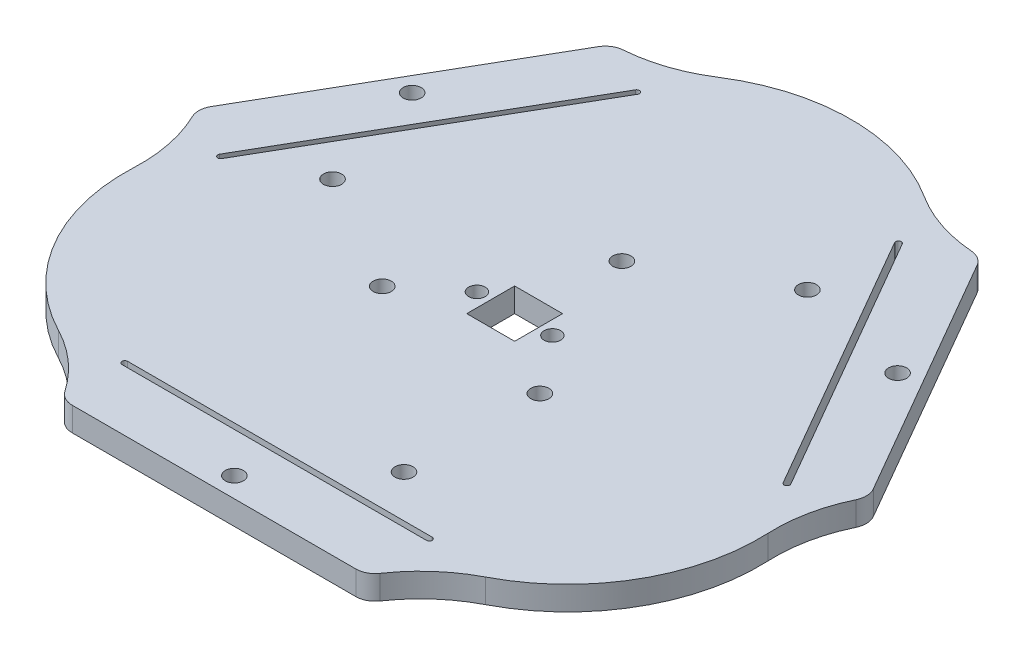
from build123d import *

# Parameters (mm, degrees)
SKETCH4_R           = 1.0999978
BOSS_EXTRUDE4_DEPTH = 3.175
SKETCH1_R           = 1.1999976
CUT_EXTRUDE7_DEPTH  = 62.35209393
CUT_EXTRUDE9_DEPTH  = 62.35209393
CIRPATTERN1_COUNT   = 3
SKETCH9_W           = 40.35933
SKETCH9_H           = 5.08
BOSS_EXTRUDE5_DEPTH = 3.175
SKETCH10_R          = 1.2
CUT_EXTRUDE10_DEPTH = 64.132493246
CIRPATTERN2_COUNT   = 3
FILLET3_R           = 20.32
FILLET4_R           = 2.54
SKETCH13_W          = 6.35
SKETCH13_H          = 6.35
CUT_EXTRUDE12_DEPTH = 63.881962359


with BuildPart() as part:
    # Sketch4 → Boss-Extrude4 (new body)
    with BuildSketch(Plane(origin=(0, 0, 0), x_dir=(1, 0, 0), z_dir=(0, 1, 0))):
        with BuildLine():
            Line((-19.99996, 34.84845233), (-40.179625, -0.10375273))
            ThreePointArc((-40.179625, -0.10375273), (-38.616778752, -22.295407608), (-20.179665, -34.744699599))
            Line((-20.179665, -34.744699599), (0, -34.744699599))
            Line((0, -34.744699599), (20.179665, -34.744699599))
            ThreePointArc((20.179665, -34.744699599), (38.616778752, -22.295407608), (40.179625, -0.10375273))
            Line((40.179625, -0.10375273), (30.0897925, 17.3723498))
            Line((30.0897925, 17.3723498), (19.99996, 34.84845233))
            ThreePointArc((19.99996, 34.84845233), (0, 44.590815215), (-19.99996, 34.84845233))
        make_face()
        with Locations(Location((-5.000000033, 0, 0), (0, 0, 270))):
            Circle(SKETCH4_R, mode=Mode.SUBTRACT)
        with Locations(Location((5.000000033, 0, 0), (0, 0, 270))):
            Circle(SKETCH4_R, mode=Mode.SUBTRACT)
    extrude(amount=BOSS_EXTRUDE4_DEPTH)

    # Sketch1 → Cut-Extrude7 (cut, through all)
    with BuildSketch(Plane(origin=(0, 3.175, 0), x_dir=(1, 0, 0), z_dir=(0, 1, 0))):
        with Locations(Location((10.835999918, -25.497765942, 0), (0, 0, 270))):
            Circle(SKETCH1_R)
        with Locations(Location((10.835999918, -7.497801942, 0), (0, 0, 270))):
            Circle(SKETCH1_R)
        with Locations(Location((-11.911286913, -5.635350233, 0), (0, 0, 270))):
            Circle(SKETCH1_R)
        with Locations(Location((-27.499713005, 3.364631767, 0), (0, 0, 270))):
            Circle(SKETCH1_R)
        with Locations(Location((1.075286995, 13.133152175, 0), (0, 0, 270))):
            Circle(SKETCH1_R)
        with Locations(Location((16.663713087, 22.133134175, 0), (0, 0, 270))):
            Circle(SKETCH1_R)
    extrude(amount=-CUT_EXTRUDE7_DEPTH, mode=Mode.SUBTRACT)

    # Sketch6 → Cut-Extrude9 (cut, through all)
    with BuildSketch(Plane(origin=(0, 3.175, 0), x_dir=(1, 0, 0), z_dir=(0, 1, 0))):
        with BuildLine():
            Line((-20.179665, -31.862440942), (20.179665, -31.862440942))
            ThreePointArc((20.179665, -31.862440942), (20.554442, -31.487663942), (20.179665, -31.112886942))
            Line((20.179665, -31.112886942), (-20.179665, -31.112886942))
            ThreePointArc((-20.179665, -31.112886942), (-20.554442, -31.487663942), (-20.179665, -31.862440942))
        make_face()
    cut_extrude9 = extrude(amount=-CUT_EXTRUDE9_DEPTH, mode=Mode.SUBTRACT)

    # CirPattern1: Cut-Extrude9 ×3 about axis
    cirpattern1_axis = Axis((0, 0, -0.195474675), (0, 1, 0))
    for i in range(1, CIRPATTERN1_COUNT):
        add(cut_extrude9.rotate(cirpattern1_axis, i * 360 / CIRPATTERN1_COUNT), mode=Mode.SUBTRACT)

    # Sketch9 → Boss-Extrude5 (add)
    with BuildSketch(Plane(origin=(0, 3.175, 0), x_dir=(1, 0, 0), z_dir=(0, 1, 0))):
        Polygon((-19.99996, 34.84845233), (-24.399369051, 37.38845233), (-44.579034051, 2.43624727), (-40.179625, -0.10375273), align=None)
        with Locations((0, -37.284699599)):
            Rectangle(SKETCH9_W, SKETCH9_H)
        Polygon((19.99996, 34.84845233), (24.399369051, 37.38845233), (44.579034051, 2.43624727), (40.179625, -0.10375273), align=None)
    extrude(amount=-BOSS_EXTRUDE5_DEPTH)

    # Sketch10 → Cut-Extrude10 (cut, through all)
    with BuildSketch(Plane(origin=(0, 3.175, 0), x_dir=(1, 0, 0), z_dir=(0, 1, 0))):
        with Locations(Location((-32.140098419, 18.556094474, 0), (0, 0, 270))):
            Circle(SKETCH10_R)
    cut_extrude10 = extrude(amount=-CUT_EXTRUDE10_DEPTH, mode=Mode.SUBTRACT)

    # CirPattern2: Cut-Extrude10 ×3 about axis
    cirpattern2_axis = Axis((0.026468548, 0, 0.018558184), (0, 1, 0))
    for i in range(1, CIRPATTERN2_COUNT):
        add(cut_extrude10.rotate(cirpattern2_axis, i * 360 / CIRPATTERN2_COUNT), mode=Mode.SUBTRACT)

    # Fillet3
    # the kernel refuses this fillet: 20.32 mm, written as the material it adds along each edge
    with BuildSketch(Plane(origin=(-19.99996, 0, -34.84845233), x_dir=(0.7399559261961443, 0, -0.6726553555032522), z_dir=(0, 1, 0)), Plane(origin=(-20.179665, 0, 34.744699599), x_dir=(-0.9525145889555402, 0, -0.3044929520150809), z_dir=(0, 1, 0))) as fillet3_piece_1:
        with BuildLine():
            CenterArc((11.947307306, 20.031233261), FILLET3_R, 228.388118158, 31.941023553)
            Line((-1.546824196, 4.838774112), (-1.816706826, 4.534924929))
            ThreePointArc((-1.816706826, 4.534924929), (-1.160514027, 2.29564112), (-0.387101929, -0.123745936))
            Line((-0.387101929, -0.123745936), (0.068270327, -0.400624665))
            ThreePointArc((0.068270327, -0.400624665), (4.266895466, -0.045441577), (8.465520605, -0.400624665))
            Line((8.465520605, -0.400624665), (8.533790933, 0))
        make_face()
    extrude(amount=3.175)
    with BuildSketch(Plane(origin=(19.99996, 0, -34.84845233), x_dir=(-0.7399559261961431, 0, -0.6726553555032532), z_dir=(0, 1, 0)), Plane(origin=(20.179665, 0, 34.744699599), x_dir=(0.9525145889555428, 0, -0.3044929520150728), z_dir=(0, 1, 0))) as fillet3_piece_2:
        with BuildLine():
            CenterArc((11.947307306, -20.031233261), FILLET3_R, 99.67085829, 31.941023553)
            Line((-1.546824196, -4.838774112), (-1.816706826, -4.534924929))
            ThreePointArc((-1.816706826, -4.534924929), (-1.160514027, -2.29564112), (-0.387101929, 0.123745936))
            Line((-0.387101929, 0.123745936), (0.068270327, 0.400624665))
            ThreePointArc((0.068270327, 0.400624665), (4.266895466, 0.045441577), (8.465520605, 0.400624665))
            Line((8.465520605, 0.400624665), (8.533790933, 0))
        make_face()
    extrude(amount=3.175)
    with BuildSketch(Plane(origin=(40.179625, 0, 0.10375273), x_dir=(0.8660254037844389, 0, -0.4999999999999995), z_dir=(0, 1, 0))) as fillet3_piece_3:
        with BuildLine():
            CenterArc((15.442171046, -17.479353856), FILLET3_R, 120.660456863, 31.941023553)
            Line((-2.598479193, -8.128560362), (-2.959292198, -7.941544493))
            ThreePointArc((-2.959292198, -7.941544493), (-1.342523361, -4.050443541), (-0.402388672, 0.056958904))
            Line((-0.402388672, 0.056958904), (0, 0.4064))
            ThreePointArc((0, 0.4064), (2.54, 0.4064), (4.872756579, 0.349587077))
            Line((4.872756579, 0.349587077), (5.08, 0))
        make_face()
    extrude(amount=3.175)
    with BuildSketch(Plane(origin=(-40.179625, 0, 0.10375273), x_dir=(-0.8660254037844382, 0, -0.500000000000001), z_dir=(0, 1, 0))) as fillet3_piece_4:
        with BuildLine():
            CenterArc((15.442171046, 17.479353856), FILLET3_R, 207.398519584, 31.941023553)
            Line((-2.598479193, 8.128560362), (-2.959292198, 7.941544493))
            ThreePointArc((-2.959292198, 7.941544493), (-1.342523361, 4.050443541), (-0.402388672, -0.056958904))
            Line((-0.402388672, -0.056958904), (0, -0.4064))
            ThreePointArc((0, -0.4064), (2.54, -0.4064), (4.872756579, -0.349587077))
            Line((4.872756579, -0.349587077), (5.08, 0))
        make_face()
    extrude(amount=3.175)

    # Fillet4
    fillet4_edges = [part.edges().sort_by_distance(p)[0] for p in [
        (-44.579034051, 1.5875, -2.43624727),
        (-24.399369051, 1.5875, -37.38845233),
        (20.179665, 1.5875, 39.824699599),
        (-20.179665, 1.5875, 39.824699599),
        (24.399369051, 1.5875, -37.38845233),
        (44.579034051, 1.5875, -2.43624727),
    ]]
    fillet(fillet4_edges, radius=FILLET4_R)

    # Sketch13 → Cut-Extrude12 (cut, through all)
    with BuildSketch(Plane(origin=(0, 3.175, 0), x_dir=(1, 0, 0), z_dir=(0, 1, 0))):
        Rectangle(SKETCH13_W, SKETCH13_H)
    extrude(amount=-CUT_EXTRUDE12_DEPTH, mode=Mode.SUBTRACT)


solid = part.part
